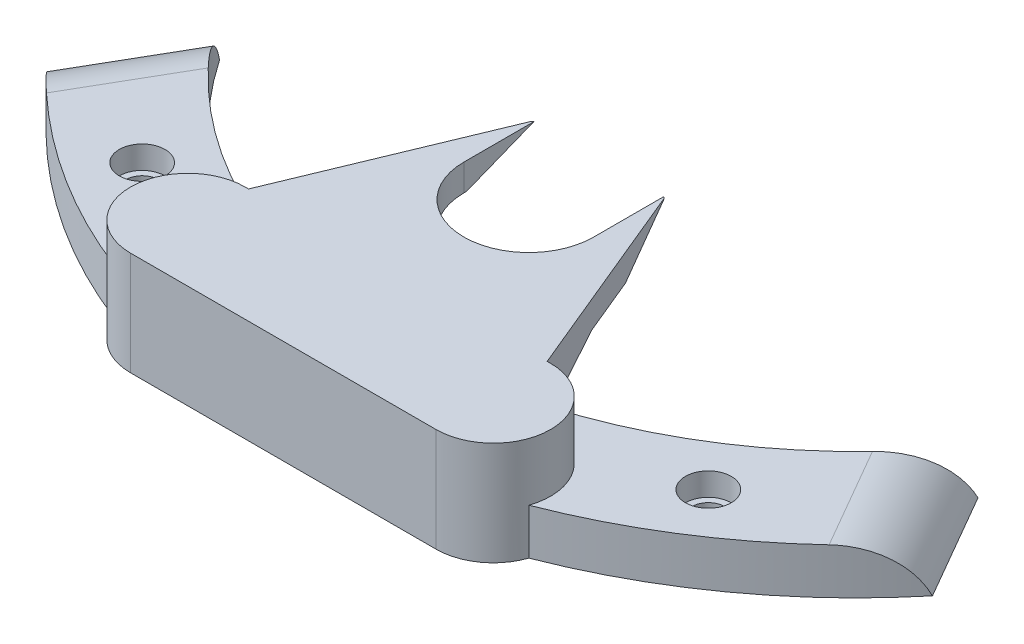
from build123d import *

# Parameters (mm, degrees)
BOSS_EXTRUDE1_DEPTH      = 13.57
BOSS_EXTRUDE3_DEPTH      = 3.5
BOSS_EXTRUDE4_DEPTH      = 26
BOSS_EXTRUDE4_DEPTH_BACK = 27
CUT_EXTRUDE1_DEPTH       = 45.729836908
CUT_EXTRUDE1_DEPTH_BACK  = 45.729836908
CUT_EXTRUDE2_DEPTH       = 46.64535365
CUT_EXTRUDE2_DEPTH_BACK  = 46.64535365
BOSS_EXTRUDE5_DEPTH      = 6
FILLET1_R                = 10
SKETCH8_R                = 2.15
CUT_EXTRUDE3_DEPTH       = 68.384074457
SKETCH8_4_R              = 3
SKETCH8_4_R_2            = 2.15
CUT_EXTRUDE4_DEPTH       = 3


with BuildPart() as part:
    # Sketch1 → Boss-Extrude1 (new body)
    with BuildSketch(Plane(origin=(0, 0, 0), x_dir=(1, 0, 0), z_dir=(0, 1, 0))):
        with BuildLine():
            Line((20, 7.5), (-20, 7.5))
            ThreePointArc((-20, 7.5), (-27.5, 0), (-20, -7.5))
            Line((-20, -7.5), (20, -7.5))
            ThreePointArc((20, -7.5), (27.5, 0), (20, 7.5))
        make_face()
    extrude(amount=BOSS_EXTRUDE1_DEPTH)

    # Sketch3 → Boss-Extrude3 (add)
    with BuildSketch(Plane(origin=(0, 13.57, 0), x_dir=(-1, 0, 0), z_dir=(0, -1, 0))):
        with BuildLine():
            Line((-19.549061387, 7.5), (19.549061387, 7.5))
            Line((19.549061387, 7.5), (12.499372909, 24.519453536))
            ThreePointArc((12.499372909, 24.519453536), (0, 12.144660941), (-12.499372909, 24.519453536))
            Line((-12.499372909, 24.519453536), (-19.549061387, 7.5))
        make_face()
        with BuildLine():
            ThreePointArc((-12.499372909, 24.519453536), (0, 12.144660941), (12.499372909, 24.519453536))
            Line((12.499372909, 24.519453536), (8.749856339, 33.57158729))
            ThreePointArc((8.749856339, 33.57158729), (8.625750618, 33.691562414), (8.5, 33.809812331))
            Line((8.5, 33.809812331), (8.5, 24.644660941))
            ThreePointArc((8.5, 24.644660941), (0, 16.144660941), (-8.5, 24.644660941))
            Line((-8.5, 24.644660941), (-8.5, 33.809812331))
            ThreePointArc((-8.5, 33.809812331), (-8.625750618, 33.691562414), (-8.749856339, 33.57158729))
            Line((-8.749856339, 33.57158729), (-12.499372909, 24.519453536))
        make_face()
    extrude(amount=BOSS_EXTRUDE3_DEPTH)

    # Sketch4 → Boss-Extrude4 (add, two sides: drawn at the far end of the back side and taken through both)
    with BuildSketch(Plane(origin=(0, 0, 0), x_dir=(0, 0, -1), z_dir=(1, 0, 0)).offset(-BOSS_EXTRUDE4_DEPTH_BACK)):
        Polygon((7.5, 10.07), (7.5, 7.17), (17.5, 10.07), align=None)
    extrude(amount=BOSS_EXTRUDE4_DEPTH + BOSS_EXTRUDE4_DEPTH_BACK)

    # Sketch5 → Cut-Extrude1 (cut, two sides: drawn at the far end of the back side and taken through both)
    with BuildSketch(Plane(origin=(0, 10.07, 0), x_dir=(1, 0, 0), z_dir=(0, 1, 0)).offset(-CUT_EXTRUDE1_DEPTH_BACK)):
        Polygon((-19.549061387, 7.5), (-15.406925764, 17.5), (-27, 17.5), (-27, 7.5), (-20, 7.5), align=None)
        Polygon((15.406925764, 17.5), (19.549061387, 7.5), (20, 7.5), (26, 7.5), (26, 17.5), align=None)
        with BuildLine():
            Line((4.604760585, 17.5), (-4.604760585, 17.5))
            ThreePointArc((-4.604760585, 17.5), (0, 16.144660941), (4.604760585, 17.5))
        make_face()
    extrude(amount=CUT_EXTRUDE1_DEPTH + CUT_EXTRUDE1_DEPTH_BACK, mode=Mode.SUBTRACT)

    # Sketch6 → Cut-Extrude2 (cut, two sides: drawn at the far end of the back side and taken through both)
    with BuildSketch(Plane(origin=(0, 0, 0), x_dir=(0, 0, -1), z_dir=(1, 0, 0)).offset(-CUT_EXTRUDE2_DEPTH_BACK)):
        Polygon((32.504181683, 4.538254004), (33.809812331, 6.646903952), (33.809812331, 13.57), (25, 10.07), align=None)
    extrude(amount=CUT_EXTRUDE2_DEPTH + CUT_EXTRUDE2_DEPTH_BACK, mode=Mode.SUBTRACT)

    # Sketch7 → Boss-Extrude5 (add)
    with BuildSketch(Plane(origin=(0, 0, 0), x_dir=(1, 0, 0), z_dir=(0, 1, 0))):
        with BuildLine():
            Line((57.794508063, 19.700472411), (49.648476863, 33.809812331))
            ThreePointArc((49.648476863, 33.809812331), (0, 7.5), (-49.648476863, 33.809812331))
            Line((-49.648476863, 33.809812331), (-57.794508063, 19.700472411))
            ThreePointArc((-57.794508063, 19.700472411), (-31.93771633, -0.360019714), (-3.1e-07, -7.5))
            ThreePointArc((-3.1e-07, -7.5), (31.93771605, -0.360019846), (57.794508063, 19.700472411))
        make_face()
    extrude(amount=BOSS_EXTRUDE5_DEPTH)

    # Fillet1
    # the kernel refuses this fillet: 10 mm, written as the material it takes off along each edge
    with BuildSketch(Plane(origin=(-38.192037625, 6, -53.652947164), x_dir=(0.8660254037844376, 0, 0.5000000000000019), z_dir=(-0.5000000000000019, 0, 0.8660254037844376))) as fillet1_piece_1:
        with BuildLine():
            CenterArc((9.16515139, -10), FILLET1_R, 90, 66.421821522)
            Line((0, -6), (-0.183303028, -5.92))
            ThreePointArc((-0.183303028, -5.92), (-0.2, -3), (-0.2, 0))
            Line((-0.2, 0), (0, 0.2))
            Line((0, 0.2), (9.16515139, 0.2))
            Line((9.16515139, 0.2), (9.16515139, 0))
        make_face()
    extrude(amount=62.117819351, mode=Mode.SUBTRACT)
    with BuildSketch(Plane(origin=(69.250947301, 6, 0.142662422), x_dir=(0, -1, 0), z_dir=(-0.5000000000000019, 0, -0.8660254037844376))) as fillet1_piece_2:
        with BuildLine():
            CenterArc((10, 9.16515139), FILLET1_R, 180, 66.421821522)
            Line((0, 9.16515139), (-0.2, 9.16515139))
            Line((-0.2, 9.16515139), (-0.2, 0))
            Line((-0.2, 0), (0, -0.2))
            ThreePointArc((0, -0.2), (3, -0.2), (5.92, -0.183303028))
            Line((5.92, -0.183303028), (6, 0))
        make_face()
    extrude(amount=62.117819351, mode=Mode.SUBTRACT)

    # Sketch8 → Cut-Extrude3 (cut, through all)
    with BuildSketch(Plane(origin=(0, 6, 0), x_dir=(1, 0, 0), z_dir=(0, 1, 0))):
        with Locations(Location((37.064396977, 11.087510982, 0), (0, 0, 270))):
            Circle(SKETCH8_R)
        with Locations(Location((-37.064396977, 11.087510982, 0), (0, 0, 270))):
            Circle(SKETCH8_R)
    extrude(amount=-CUT_EXTRUDE3_DEPTH, mode=Mode.SUBTRACT)

    # Sketch8<4> → Cut-Extrude4 (cut)
    # profile 1 of 2: a face of its own
    with BuildSketch(Plane(origin=(0, 6, 0), x_dir=(1, 0, 0), z_dir=(0, 1, 0))):
        with Locations(Location((37.064396977, 11.087510982, 0), (0, 0, 270))):
            Circle(SKETCH8_4_R)
        with Locations(Location((37.064396977, 11.087510982, 0), (0, 0, 270))):
            Circle(SKETCH8_4_R_2, mode=Mode.SUBTRACT)
    # profile 2 of 2: a face of its own
    with BuildSketch(Plane(origin=(0, 6, 0), x_dir=(1, 0, 0), z_dir=(0, 1, 0))):
        with Locations(Location((-37.064396977, 11.087510982, 0), (0, 0, 90))):
            Circle(SKETCH8_4_R)
        with Locations(Location((-37.064396977, 11.087510982, 0), (0, 0, 270))):
            Circle(SKETCH8_4_R_2, mode=Mode.SUBTRACT)
    extrude(amount=-CUT_EXTRUDE4_DEPTH, mode=Mode.SUBTRACT)


solid = part.part
